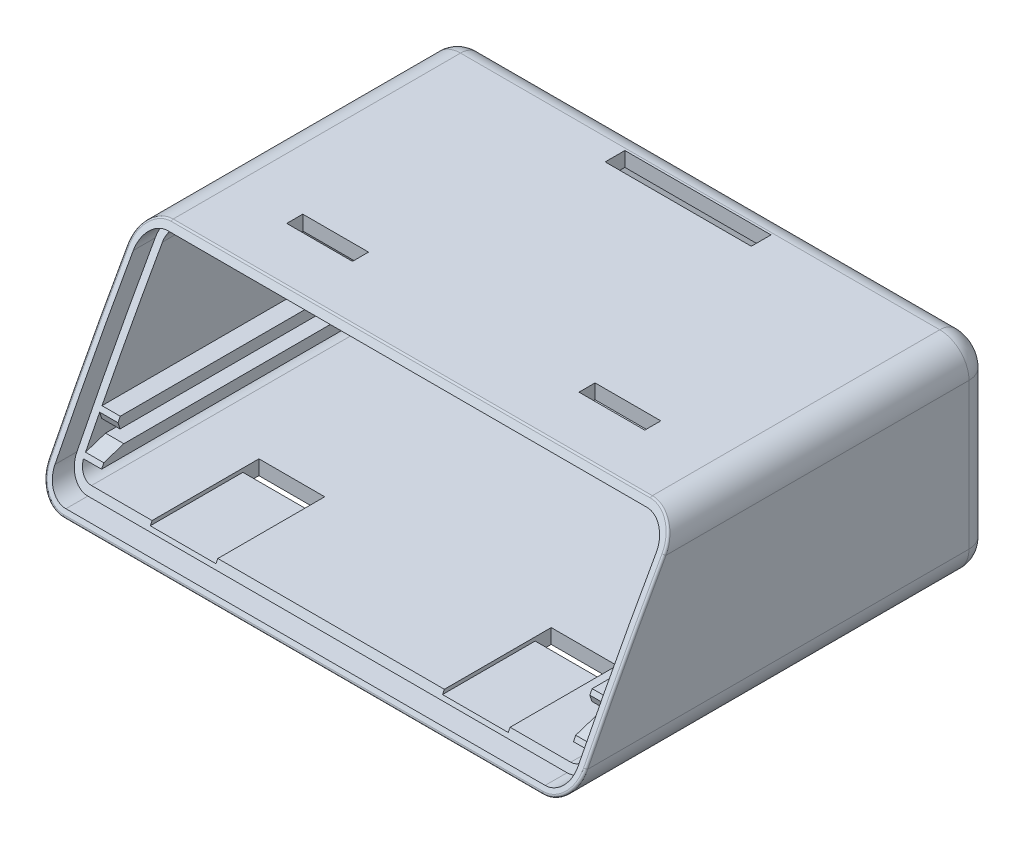
from build123d import *

# Parameters (mm, degrees)
SKETCH1_W                = 73.58
SKETCH1_H                = 57.5
BOSS_EXTRUDE1_DEPTH      = 28
FILLET1_R                = 4
SHELL1_T                 = -2
CUT_EXTRUDE1_DEPTH       = 84.812760962
FILLET2_R                = 3
CUT_EXTRUDE3_REACH       = 154.234
CUT_EXTRUDE3_END_RADIUS  = 475
CUT_EXTRUDE3_START       = 80
FILLET3_R                = 0.3
BOSS_EXTRUDE2_REACH      = 74.094
BOSS_EXTRUDE2_END_RADIUS = 475
SKETCH5_W                = 2.5
SKETCH5_H                = 1.5
SKETCH6_W                = 14.3
SKETCH6_H                = 16.7
SKETCH6_W_2              = 11.05
SKETCH6_H_2              = 14.049996967
CUT_EXTRUDE4_DEPTH       = 2
SKETCH7_W                = 9
SKETCH7_H                = 2.2
CUT_EXTRUDE5_DEPTH       = 2
SKETCH11_W               = 9
SKETCH11_H               = 2.2
CUT_EXTRUDE8_DEPTH       = 2
SKETCH8_W                = 20
SKETCH8_H                = 2.4
CUT_EXTRUDE6_DEPTH       = 2
SKETCH9_W                = 9
SKETCH9_H                = 0.5
CUT_EXTRUDE7_DEPTH       = 62.847154512
SKETCH12_W               = 9
SKETCH12_H               = 0.5
CUT_EXTRUDE9_DEPTH       = 59.035424699
SKETCH10_W               = 13.75
SKETCH10_H               = 1.6
SKETCH10_W_2             = 27.64
SKETCH10_H_2             = 2
SKETCH10_W_3             = 2.84
BOSS_EXTRUDE3_DEPTH      = 0.5
CHAMFER1_START           = -34.79
CHAMFER1_DEPTH           = 69.58
SKETCH13_W               = 20
SKETCH13_H               = 2
CUT_EXTRUDE10_DEPTH      = 0.3


with BuildPart() as part:
    # Sketch1 → Boss-Extrude1 (new body)
    with BuildSketch(Plane(origin=(0, 0, 0), x_dir=(1, 0, 0), z_dir=(0, 1, 0))):
        Rectangle(SKETCH1_W, SKETCH1_H)
    extrude(amount=BOSS_EXTRUDE1_DEPTH)

    # Fillet1
    fillet1_edges = [part.edges().sort_by_distance(p)[0] for p in [
        (-36.79, 28, 0),
        (36.79, 28, 0),
        (-36.79, 0, 0),
        (36.79, 0, 0),
    ]]
    fillet(fillet1_edges, radius=FILLET1_R)

    # Shell1
    shell1_openings = [part.faces().sort_by_distance(p)[0] for p in [
        (0, 14, 28.75),
    ]]
    offset(amount=SHELL1_T, openings=shell1_openings, kind=Kind.INTERSECTION)

    # Sketch2 → Cut-Extrude1 (cut, through all)
    with BuildSketch(Plane.ZY.offset(36.79)):
        with BuildLine():
            Line((13.75, 28), (28.75, 28))
            Line((28.75, 28), (28.75, 0))
            ThreePointArc((28.75, 0), (21.484121584, 14.125422277), (13.75, 28))
        make_face()
    extrude(amount=-CUT_EXTRUDE1_DEPTH, mode=Mode.SUBTRACT)

    # Fillet2
    fillet2_edges = [part.edges().sort_by_distance(p)[0] for p in [
        (0, 28, -28.75),
        (0, 0, -28.75),
        (-36.79, 14, -28.75),
        (36.79, 14, -28.75),
        (-35.618427125, 26.828427125, -28.75),
        (-35.618427125, 1.171572875, -28.75),
        (35.618427125, 1.171572875, -28.75),
        (35.618427125, 26.828427125, -28.75),
    ]]
    fillet(fillet2_edges, radius=FILLET2_R)

    # Cut-Extrude3: up to this cylinder (the profile starts outside it)
    cut_extrude3_end = Plane(origin=(0, -210.179748667, -400.218864179), z_dir=(-1, 0, 0)) * Cylinder(CUT_EXTRUDE3_END_RADIUS, 1259.468, mode=Mode.PRIVATE)
    # Sketch4 → Cut-Extrude3 (cut, up to the surface)
    with BuildSketch(Plane.XY.offset(-26.75).offset(CUT_EXTRUDE3_START), mode=Mode.PRIVATE) as cut_extrude3_sk1:
        with BuildLine():
            Line((32.79, 27), (-32.79, 27))
            ThreePointArc((-32.79, 27), (-34.911320344, 26.121320344), (-35.79, 24))
            Line((-35.79, 24), (-35.79, 4))
            ThreePointArc((-35.79, 4), (-34.911320344, 1.878679656), (-32.79, 1))
            Line((-32.79, 1), (32.79, 1))
            ThreePointArc((32.79, 1), (34.911320344, 1.878679656), (35.79, 4))
            Line((35.79, 4), (35.79, 24))
            ThreePointArc((35.79, 24), (34.911320344, 26.121320344), (32.79, 27))
        make_face()
        with BuildLine():
            Line((32.79, 26), (-32.79, 26))
            ThreePointArc((-32.79, 26), (-34.204213562, 25.414213562), (-34.79, 24))
            Line((-34.79, 24), (-34.79, 4))
            ThreePointArc((-34.79, 4), (-34.204213562, 2.585786438), (-32.79, 2))
            Line((-32.79, 2), (32.79, 2))
            ThreePointArc((32.79, 2), (34.204213562, 2.585786438), (34.79, 4))
            Line((34.79, 4), (34.79, 24))
            ThreePointArc((34.79, 24), (34.204213562, 25.414213562), (32.79, 26))
        make_face(mode=Mode.SUBTRACT)
    cut_extrude3_tool1 = extrude(cut_extrude3_sk1.sketch, amount=-CUT_EXTRUDE3_REACH, mode=Mode.PRIVATE) - cut_extrude3_end
    add(cut_extrude3_tool1.solids().sort_by_distance((0, 26.238443, 53.25))[0], mode=Mode.SUBTRACT)

    # Fillet3
    fillet3_edges = [part.edges().sort_by_distance(p)[0] for p in [
        (0, 0, 28.75),
        (-36.79, 14.0639546, 21.517044891),
        (35.714985447, 26.728453829, 14.484309952),
        (35.696759265, 1.252137055, 28.129884144),
        (-35.696759265, 1.252137055, 28.129884144),
        (-35.714985447, 26.728453829, 14.484309952),
        (36.79, 14.0639546, 21.517044891),
        (0, 28, 13.75),
    ]]
    fillet(fillet3_edges, radius=FILLET3_R)

    # Boss-Extrude2: up to this cylinder (the profile starts inside it)
    boss_extrude2_end = Plane(origin=(0, -210.179748667, -400.218864179), z_dir=(-1, 0, 0)) * Cylinder(BOSS_EXTRUDE2_END_RADIUS, 1166.268, mode=Mode.PRIVATE)
    # Sketch5 → Boss-Extrude2 (add, up to the surface)
    with BuildSketch(Plane.XY.offset(-26.75), mode=Mode.PRIVATE) as boss_extrude2_sk1:
        with Locations((33.54, 4.5)):
            Rectangle(SKETCH5_W, SKETCH5_H)
    boss_extrude2_tool1 = extrude(boss_extrude2_sk1.sketch, amount=BOSS_EXTRUDE2_REACH, mode=Mode.PRIVATE) & boss_extrude2_end
    add(boss_extrude2_tool1.solids().sort_by_distance((33.54, 4.5, -26.75))[0])
    # Sketch5 → Boss-Extrude2 (add, up to the surface)
    with BuildSketch(Plane.XY.offset(-26.75), mode=Mode.PRIVATE) as boss_extrude2_sk2:
        with Locations((33.54, 8)):
            Rectangle(SKETCH5_W, SKETCH5_H)
    boss_extrude2_tool2 = extrude(boss_extrude2_sk2.sketch, amount=BOSS_EXTRUDE2_REACH, mode=Mode.PRIVATE) & boss_extrude2_end
    add(boss_extrude2_tool2.solids().sort_by_distance((33.54, 8, -26.75))[0])
    # Sketch5 → Boss-Extrude2 (add, up to the surface)
    with BuildSketch(Plane.XY.offset(-26.75), mode=Mode.PRIVATE) as boss_extrude2_sk3:
        with Locations((-33.54, 8)):
            Rectangle(SKETCH5_W, SKETCH5_H)
    boss_extrude2_tool3 = extrude(boss_extrude2_sk3.sketch, amount=BOSS_EXTRUDE2_REACH, mode=Mode.PRIVATE) & boss_extrude2_end
    add(boss_extrude2_tool3.solids().sort_by_distance((-33.54, 8, -26.75))[0])
    # Sketch5 → Boss-Extrude2 (add, up to the surface)
    with BuildSketch(Plane.XY.offset(-26.75), mode=Mode.PRIVATE) as boss_extrude2_sk4:
        with Locations((-33.54, 4.5)):
            Rectangle(SKETCH5_W, SKETCH5_H)
    boss_extrude2_tool4 = extrude(boss_extrude2_sk4.sketch, amount=BOSS_EXTRUDE2_REACH, mode=Mode.PRIVATE) & boss_extrude2_end
    add(boss_extrude2_tool4.solids().sort_by_distance((-33.54, 4.5, -26.75))[0])

    # Sketch6 → Cut-Extrude4 (cut)
    with BuildSketch(Plane(origin=(0, 0, -28.75), x_dir=(-1, 0, 0), z_dir=(0, 0, -1))):
        with Locations((0, 10.35)):
            Rectangle(SKETCH6_W, SKETCH6_H)
        with Locations((26.425, 10.175001517)):
            Rectangle(SKETCH6_W_2, SKETCH6_H_2)
    extrude(amount=-CUT_EXTRUDE4_DEPTH, mode=Mode.SUBTRACT)

    # Sketch7 → Cut-Extrude5 (cut)
    with BuildSketch(Plane(origin=(0, 28, 0), x_dir=(1, 0, 0), z_dir=(0, 1, 0))):
        with Locations((-20, -5.23)):
            Rectangle(SKETCH7_W, SKETCH7_H)
        with Locations((20, -5.23)):
            Rectangle(SKETCH7_W, SKETCH7_H)
    extrude(amount=-CUT_EXTRUDE5_DEPTH, mode=Mode.SUBTRACT)

    # Sketch11 → Cut-Extrude8 (cut)
    with BuildSketch(Plane.XZ):
        with Locations((-20, 11.23)):
            Rectangle(SKETCH11_W, SKETCH11_H)
        with Locations((20, 11.23)):
            Rectangle(SKETCH11_W, SKETCH11_H)
    extrude(amount=-CUT_EXTRUDE8_DEPTH, mode=Mode.SUBTRACT)

    # Sketch8 → Cut-Extrude6 (cut)
    with BuildSketch(Plane(origin=(0, 28, 0), x_dir=(1, 0, 0), z_dir=(0, 1, 0))):
        with Locations((0, 23.95)):
            Rectangle(SKETCH8_W, SKETCH8_H)
    extrude(amount=-CUT_EXTRUDE6_DEPTH, mode=Mode.SUBTRACT)

    # Sketch9 → Cut-Extrude7 (cut, through all)
    with BuildSketch(Plane(origin=(0, 0, 12.33), x_dir=(-1, 0, 0), z_dir=(0, 0, -1))):
        with Locations((20, 1.75)):
            Rectangle(SKETCH9_W, SKETCH9_H)
        with Locations((-20, 1.75)):
            Rectangle(SKETCH9_W, SKETCH9_H)
    extrude(amount=-CUT_EXTRUDE7_DEPTH, mode=Mode.SUBTRACT)

    # Sketch12 → Cut-Extrude9 (cut, through all)
    with BuildSketch(Plane(origin=(0, 0, 6.33), x_dir=(-1, 0, 0), z_dir=(0, 0, -1))):
        with Locations((20, 26.25)):
            Rectangle(SKETCH12_W, SKETCH12_H)
        with Locations((-20, 26.25)):
            Rectangle(SKETCH12_W, SKETCH12_H)
    extrude(amount=-CUT_EXTRUDE9_DEPTH, mode=Mode.SUBTRACT)

    # Sketch10 → Boss-Extrude3 (add)
    with BuildSketch(Plane.XY.offset(-26.75)):
        with Locations((-14.025, 6.25)):
            Rectangle(SKETCH10_W, SKETCH10_H)
        with Locations((20.97, 6.25)):
            Rectangle(SKETCH10_W_2, SKETCH10_H_2)
        with Locations((-33.37, 6.25)):
            Rectangle(SKETCH10_W_3, SKETCH10_H_2)
    extrude(amount=BOSS_EXTRUDE3_DEPTH)

    # Chamfer1: read off the stored shape, not the designer's step
    # Chamfer1 outline → Chamfer1 (cut)
    with BuildSketch(Plane.YZ.offset(CHAMFER1_START)):
        with BuildLine():
            ThreePointArc((8.137667838, 21.63716061), (7.693954372, 21.866493923), (7.25, 22.095360533))
            Line((7.25, 22.095360533), (7.25, 21.352876009))
            Line((7.25, 21.352876009), (8.137667838, 21.63716061))
        make_face()
        with BuildLine():
            Line((4.359221973, 23.571213662), (5.25, 20.834427816))
            Line((5.25, 20.834427816), (5.25, 23.11908993))
            ThreePointArc((5.25, 23.11908993), (4.804729842, 23.345385965), (4.359221973, 23.571213662))
        make_face()
    extrude(amount=CHAMFER1_DEPTH, mode=Mode.SUBTRACT)

    # Sketch13 → Cut-Extrude10 (cut)
    with BuildSketch(Plane.XY.offset(-25.15)):
        with Locations((0, 27)):
            Rectangle(SKETCH13_W, SKETCH13_H)
    extrude(amount=-CUT_EXTRUDE10_DEPTH, mode=Mode.SUBTRACT)


solid = part.part
